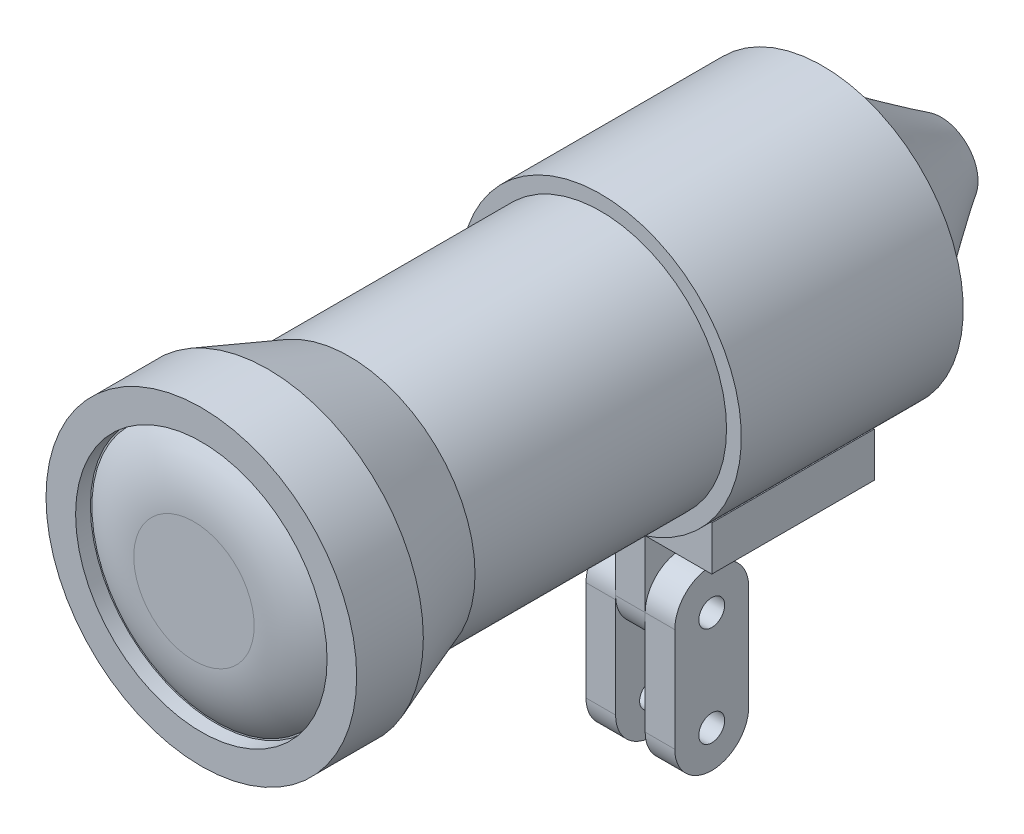
from build123d import *

# Parameters (mm, degrees)
SKETCH1_R            = 8.5
BOSS_EXTRUDE1_DEPTH  = 17
SKETCH2_R            = 10.5
BOSS_EXTRUDE2_DEPTH  = 10
CHAMFER1_SIZE        = 5.494954839
CHAMFER1_SIZE_2      = 2
SKETCH3_R            = 8.5
CUT_EXTRUDE1_DEPTH   = 1
SKETCH4_R            = 9.5
BOSS_EXTRUDE3_DEPTH  = 15
SKETCH9_W            = 11
SKETCH9_H            = 11
BOSS_EXTRUDE4_DEPTH  = 3
SKETCH10_W           = 2
SKETCH10_H           = 5
BOSS_EXTRUDE5_DEPTH  = 7
FILLET1_R            = 2.5
SKETCH13_R           = 8.4
BOSS_EXTRUDE7_DEPTH  = 1.5
FILLET3_R            = 7
SKETCH14_W           = 5
SKETCH14_H           = 12
BOSS_EXTRUDE9_DEPTH  = 2
SKETCH15_W           = 5
SKETCH15_H           = 11.75
BOSS_EXTRUDE10_DEPTH = 2
FILLET4_START        = -5.5
FILLET4_DEPTH        = 4.5
FILLET4_START_2      = 1
FILLET4_2_DEPTH      = 4.5
CUT_EXTRUDE3_REACH   = 51.064
SKETCH16_R           = 0.875


with BuildPart() as part:
    # Sketch1 → Boss-Extrude1 (new body)
    with BuildSketch(Plane.XY):
        Circle(SKETCH1_R)
    extrude(amount=-BOSS_EXTRUDE1_DEPTH)

    # Sketch2 → Boss-Extrude2 (add)
    with BuildSketch(Plane.XY):
        Circle(SKETCH2_R)
    extrude(amount=BOSS_EXTRUDE2_DEPTH)

    # Chamfer1
    # the kernel refuses this chamfer: 5.494954839, 2 mm, written as the material it takes off along each edge
    with BuildSketch(Plane(origin=(0, 0, 0), x_dir=(1, 0, 0), z_dir=(0, -1, 0))) as chamfer1_piece_1_section:
        Polygon((10.5, CHAMFER1_SIZE), (10.5 - CHAMFER1_SIZE_2, 0), (10.5, 0), align=None)
    chamfer1_piece_1 = revolve(axis=Axis((0, 0, 0), (0, 0, 1)), mode=Mode.PRIVATE)
    chamfer1_piece_1 = chamfer1_piece_1 - Plane(origin=(0, 0, 0), x_dir=(1, 0, 0), z_dir=(0, 0, 1)) * Cylinder(8.5, 42, mode=Mode.PRIVATE)
    add(chamfer1_piece_1, mode=Mode.SUBTRACT)

    # Sketch3 → Cut-Extrude1 (cut)
    with BuildSketch(Plane.XY.offset(10)):
        Circle(SKETCH3_R)
    extrude(amount=-CUT_EXTRUDE1_DEPTH, mode=Mode.SUBTRACT)

    # Sketch4 → Boss-Extrude3 (add)
    with BuildSketch(Plane(origin=(0, 0, -17), x_dir=(-1, 0, 0), z_dir=(0, 0, -1))):
        Circle(SKETCH4_R)
    extrude(amount=BOSS_EXTRUDE3_DEPTH)

    # Loft2: read off the stored shape, not the designer's step
    # Loft2: loft between two sections, ruled curve by curve
    loft2_from = [
        Edge.make_bspline([(5.6816796, 5.631919471, -32), (16.945518542, -5.731439728, -32), (5.582159343, -16.99527867, -32), (-5.6816796, -5.631919471, -32), (-16.945518542, 5.731439728, -32), (-5.582159343, 16.99527867, -32), (5.6816796, 5.631919471, -32)], [0, 0, 0, 0, 0.5, 0.5, 0.5, 1, 1, 1, 1], 3, [1, 0.333333333, 0.333333333, 1, 0.333333333, 0.333333333, 1]),
    ]
    loft2_to = [
        Edge.make_bspline([(2.275915377, 1.034509157, -40), (4.344933691, -3.517321597, -40), (-0.206897063, -5.586339911, -40), (-2.275915377, -1.034509157, -40), (-4.344933691, 3.517321597, -40), (0.206897063, 5.586339911, -40), (2.275915377, 1.034509157, -40)], [0, 0, 0, 0, 0.5, 0.5, 0.5, 1, 1, 1, 1], 3, [1, 0.333333333, 0.333333333, 1, 0.333333333, 0.333333333, 1]),
    ]
    loft2 = Solid(Shell([*[Face.make_surface_from_curves(loft2_from[k], loft2_to[k]) for k in range(1)], Face(Wire(loft2_from)), Face(Wire(loft2_to))]))
    add(loft2)

    # Sketch9 → Boss-Extrude4 (add)
    with BuildSketch(Plane(origin=(0, -8, 0), x_dir=(1, 0, 0), z_dir=(0, 1, 0))):
        with Locations((0, 24.5)):
            Rectangle(SKETCH9_W, SKETCH9_H)
    extrude(amount=-BOSS_EXTRUDE4_DEPTH)

    # Sketch10 → Boss-Extrude5 (add)
    with BuildSketch(Plane.XZ.offset(11)):
        with Locations((0, -21.5)):
            Rectangle(SKETCH10_W, SKETCH10_H)
    extrude(amount=BOSS_EXTRUDE5_DEPTH)

    # Fillet1
    fillet1_edges = [part.edges().sort_by_distance(p)[0] for p in [
        (0, -18, -19),
        (0, -18, -24),
    ]]
    fillet(fillet1_edges, radius=FILLET1_R - 0.0001)  # a hair under: the kernel refuses the full size

    # Sketch13 → Boss-Extrude7 (add)
    with BuildSketch(Plane.XY.offset(9)):
        Circle(SKETCH13_R)
    extrude(amount=BOSS_EXTRUDE7_DEPTH)

    # Fillet3
    # the kernel refuses this fillet: 7 mm, written as the material it takes off along each edge
    with BuildSketch(Plane(origin=(0, 0, 10.5), x_dir=(1, 0, 0), z_dir=(0, -1, 0))) as fillet3_piece_1:
        with BuildLine():
            CenterArc((4.069872981, -7), FILLET3_R, 51.786789298, 38.213210702)
            Line((4.069872981, 0), (8.4, 0))
            Line((8.4, 0), (8.4, -1.5))
        make_face()
    revolve(axis=Axis((0, 0, 10.5), (0, 0, 1)), mode=Mode.SUBTRACT)

    # Sketch14 → Boss-Extrude9 (add)
    with BuildSketch(Plane(origin=(1, 0, 0), x_dir=(0, 0, -1), z_dir=(1, 0, 0))):
        with Locations((21.5, -19)):
            Rectangle(SKETCH14_W, SKETCH14_H)
    extrude(amount=BOSS_EXTRUDE9_DEPTH)

    # Sketch15 → Boss-Extrude10 (add)
    with BuildSketch(Plane.ZY.offset(1)):
        with Locations((-21.5, -19.125)):
            Rectangle(SKETCH15_W, SKETCH15_H)
    extrude(amount=BOSS_EXTRUDE10_DEPTH)

    # Fillet4: read off the stored shape, not the designer's step
    # Fillet4 outline → Fillet4 (cut)
    with BuildSketch(Plane.YZ.offset(FILLET4_START)):
        with BuildLine():
            Line((-25, -19), (-25, -21.5))
            ThreePointArc((-25, -21.5), (-24.267766953, -19.732233047), (-22.5, -19))
            Line((-22.5, -19), (-25, -19))
        make_face()
        with BuildLine():
            ThreePointArc((-22.5, -24), (-24.267766953, -23.267766953), (-25, -21.5))
            Line((-25, -21.5), (-25, -24))
            Line((-25, -24), (-22.5, -24))
        make_face()
        with BuildLine():
            ThreePointArc((-13.25, -21.5), (-13.982233047, -23.267766953), (-15.75, -24))
            Line((-15.75, -24), (-13.25, -24))
            Line((-13.25, -24), (-13.25, -21.5))
        make_face()
        with BuildLine():
            ThreePointArc((-15.75, -19), (-13.982233047, -19.732233047), (-13.25, -21.5))
            Line((-13.25, -21.5), (-13.25, -19))
            Line((-13.25, -19), (-15.75, -19))
        make_face()
    extrude(amount=FILLET4_DEPTH, mode=Mode.SUBTRACT)

    # Fillet4 2 outline → Fillet4 2 (cut)
    with BuildSketch(Plane.YZ.offset(FILLET4_START_2)):
        with BuildLine():
            Line((-25, -19), (-25, -21.5))
            ThreePointArc((-25, -21.5), (-24.267766953, -19.732233047), (-22.5, -19))
            Line((-22.5, -19), (-25, -19))
        make_face()
        with BuildLine():
            ThreePointArc((-22.5, -24), (-24.267766953, -23.267766953), (-25, -21.5))
            Line((-25, -21.5), (-25, -24))
            Line((-25, -24), (-22.5, -24))
        make_face()
        with BuildLine():
            Line((-15.5, -24), (-13, -24))
            Line((-13, -24), (-13, -21.5))
            ThreePointArc((-13, -21.5), (-13.732233047, -23.267766953), (-15.5, -24))
        make_face()
        with BuildLine():
            ThreePointArc((-15.5, -19), (-13.732233047, -19.732233047), (-13, -21.5))
            Line((-13, -21.5), (-13, -19))
            Line((-13, -19), (-15.5, -19))
        make_face()
    extrude(amount=FILLET4_2_DEPTH, mode=Mode.SUBTRACT)

    # Cut-Extrude3: up to this face of the body (flat: up to its plane)
    cut_extrude3_end = Plane(part.part.faces().sort_by_distance((3, -19, -21.5))[0])
    # Sketch16 → Cut-Extrude3 (cut, up to the picked face)
    with BuildSketch(Plane.ZY.offset(3), mode=Mode.PRIVATE) as cut_extrude3_sk1:
        with Locations((-21.5, -15.75)):
            Circle(SKETCH16_R)
    cut_extrude3_tool1 = split(extrude(cut_extrude3_sk1.sketch, amount=-CUT_EXTRUDE3_REACH, mode=Mode.PRIVATE), bisect_by=cut_extrude3_end, keep=Keep.BOTH, mode=Mode.PRIVATE)
    # Sketch16 → Cut-Extrude3 (cut, up to the picked face)
    with BuildSketch(Plane.ZY.offset(3), mode=Mode.PRIVATE) as cut_extrude3_sk2:
        with Locations((-21.5, -22.5)):
            Circle(SKETCH16_R)
    cut_extrude3_tool2 = split(extrude(cut_extrude3_sk2.sketch, amount=-CUT_EXTRUDE3_REACH, mode=Mode.PRIVATE), bisect_by=cut_extrude3_end, keep=Keep.BOTH, mode=Mode.PRIVATE)
    add(cut_extrude3_tool1.solids().sort_by(Axis((-3, -15.75, -21.5), (1, 0, 0)))[0], mode=Mode.SUBTRACT)
    add(cut_extrude3_tool2.solids().sort_by(Axis((-3, -22.5, -21.5), (1, 0, 0)))[0], mode=Mode.SUBTRACT)


solid = part.part
